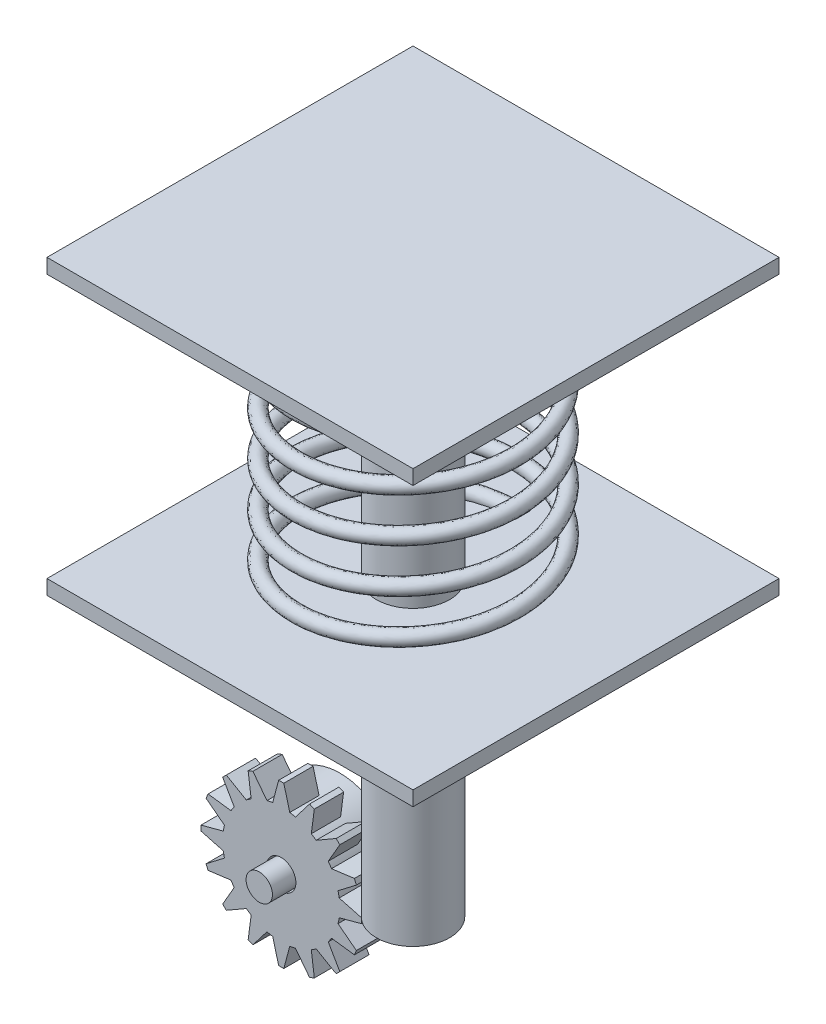
from build123d import *

# Parameters (mm, degrees)
EXTRUDE1_DEPTH       = 56
EXTRUDE1_DEPTH_BACK  = 20
SKETCH1_R            = 5
SHELL1_T             = -2
SKETCH7_W            = 50
SKETCH7_H            = 50
EXTRUDE4_DEPTH       = 2
SWEEP2_PITCH         = 6
EXTRUDE5_DEPTH       = 0.0001
EXTRUDE5_DEPTH_BACK  = 2
SKETCH10_W           = 50
SKETCH10_H           = 50
EXTRUDE9_DEPTH       = 2
EXTRUDE9_DEPTH_BACK  = 6
SKETCH14_R           = 8
SKETCH19_R           = 2
CUT_EXTRUDE2_DEPTH   = 71.356236477
EXTRUDE10_DEPTH      = 4
CIRPATTERN1_COUNT    = 16
EXTRUDE11_DEPTH      = 5
EXTRUDE11_DEPTH_BACK = 10
SKETCH21_R           = 1.8


with BuildPart() as part:
    # Sketch1 → Extrude1 (new, two sides: drawn at the far end of the back side and taken through both)
    with BuildSketch(Plane(origin=(0, 0, 0), x_dir=(1, 0, 0), z_dir=(0, 1, 0)).offset(-EXTRUDE1_DEPTH_BACK)):
        with Locations(Location((0, 0, 0), (0, 0, 270))):
            Circle(SKETCH1_R)
    extrude(amount=EXTRUDE1_DEPTH + EXTRUDE1_DEPTH_BACK)

    # Shell1
    shell1_openings = [part.faces().sort_by_distance(p)[0] for p in [
        (0, -20, 0),
    ]]
    offset(amount=SHELL1_T, openings=shell1_openings, kind=Kind.INTERSECTION)

    # Sketch7 → Extrude4 (add)
    with BuildSketch(Plane(origin=(0, 56, 0), x_dir=(-1, 0, 0), z_dir=(0, 1, 0))):
        Rectangle(SKETCH7_W, SKETCH7_H)
    extrude(amount=EXTRUDE4_DEPTH)

    # Sweep2: arcs per turn and ends read off the stored shape
    # Sweep2: the profile of Sketch9 screwed along a right-hand helix through 6 turns, 6 arcs to a turn; built about Z, then put on its axis
    sweep2_z = Axis((0, 0, 0), (0, 0, 1))
    sweep2_corners = [(15.988282835, -9.2086e-05, 0.036716591), (14.988282835, -8.6326e-05, -0.963283409), (13.988282835, -8.0567e-05, 0.036716591), (14.988282835, -8.6326e-05, 1.036716591)]
    with BuildLine(mode=Mode.PRIVATE) as sweep2_profile:
        ThreePointArc((15.988282835, -9.2086e-05, 0.036716591), (15.695389616, -9.0399e-05, -0.670390191), (14.988282835, -8.6326e-05, -0.963283409))
        ThreePointArc((14.988282835, -8.6326e-05, -0.963283409), (14.281176054, -8.2254e-05, -0.670390191), (13.988282835, -8.0567e-05, 0.036716591))
        ThreePointArc((13.988282835, -8.0567e-05, 0.036716591), (14.281176054, -8.2254e-05, 0.743823372), (14.988282835, -8.6326e-05, 1.036716591))
        ThreePointArc((14.988282835, -8.6326e-05, 1.036716591), (15.695389616, -9.0399e-05, 0.743823372), (15.988282835, -9.2086e-05, 0.036716591))
    sweep2_cap = Face(sweep2_profile.wire())
    sweep2_arcs = [((15.988282835, -9.2086e-05, 0.036716591), (15.988282835, -9.2086e-05, -0.963283409), (14.988282835, -8.6326e-05, -0.963283409), (1, 0.7071067811865476, 1)), ((14.988282835, -8.6326e-05, -0.963283409), (13.988282835, -8.0567e-05, -0.963283409), (13.988282835, -8.0567e-05, 0.036716591), (1, 0.7071067811865476, 1)), ((13.988282835, -8.0567e-05, 0.036716591), (13.988282835, -8.0567e-05, 1.036716591), (14.988282835, -8.6326e-05, 1.036716591), (1, 0.7071067811865476, 1)), ((14.988282835, -8.6326e-05, 1.036716591), (15.988282835, -9.2086e-05, 1.036716591), (15.988282835, -9.2086e-05, 0.036716591), (1, 0.7071067811865476, 1))]  # start, shoulder, end, weights
    sweep2_turn_angles = [0, 30, 60, 90, 120, 150, 180, 210, 240, 270, 300, 330, 360]
    sweep2_turn_weights = [1, 0.8660254037844387, 1, 0.8660254037844387, 1, 0.8660254037844387, 1, 0.8660254037844387, 1, 0.8660254037844387, 1, 0.8660254037844387, 1]
    sweep2_turn_sides = [Face.make_bezier_surface([[Vector(p[j][0], p[j][1], 0).rotate(sweep2_z, sweep2_turn_angles[2 * i + k]) / sweep2_turn_weights[2 * i + k] + Vector(0, 0, p[j][2] + SWEEP2_PITCH * sweep2_turn_angles[2 * i + k] / 360) for k in range(3)] for j in range(3)], [[p[3][j] * sweep2_turn_weights[2 * i + k] for k in range(3)] for j in range(3)]) for p in sweep2_arcs for i in range(6)]
    sweep2 = Plane(origin=(0, 56, 0), x_dir=(0, 0, -1), z_dir=(0, -1, 0)) * Solid(Shell([*[p.moved(Location((0, 0, SWEEP2_PITCH * i))) for i in range(6) for p in sweep2_turn_sides], sweep2_cap, sweep2_cap.rotate(sweep2_z, 2160).moved(Location((0, 0, SWEEP2_PITCH * 2160 / 360)))]))
    add(sweep2)

    # Sketch10 → Extrude5 (add, two sides: drawn at the far end of the back side and taken through both)
    with BuildSketch(Plane(origin=(0, 20, 0), x_dir=(-1, 0, 0), z_dir=(0, 1, 0)).offset(-EXTRUDE5_DEPTH_BACK)):
        Rectangle(SKETCH10_W, SKETCH10_H)
    extrude(amount=EXTRUDE5_DEPTH + EXTRUDE5_DEPTH_BACK)


with BuildPart() as body_2:
    # Sketch14 → Extrude9 (new, two sides: drawn at the far end of the back side and taken through both)
    with BuildSketch(Plane.XY.offset(-EXTRUDE9_DEPTH_BACK)):
        with Locations((-16, -22)):
            Circle(SKETCH14_R)
    extrude(amount=EXTRUDE9_DEPTH + EXTRUDE9_DEPTH_BACK)

    # Sketch19 → Cut-Extrude2 (cut, through all)
    with BuildSketch(Plane(origin=(0, 0, -6), x_dir=(-1, 0, 0), z_dir=(0, 0, -1))):
        with Locations((16, -22)):
            Circle(SKETCH19_R)
    extrude(amount=-CUT_EXTRUDE2_DEPTH, mode=Mode.SUBTRACT)

    # Sketch20 → Extrude10 (add)
    with BuildSketch(Plane.XY.offset(2)):
        Polygon((-17.4, -14.949083343), (-14.6, -14.949083343), (-15.648555205, -11.035822043), (-16.351444795, -11.035822043), align=None)
    extrude10 = extrude(amount=-EXTRUDE10_DEPTH)

    # CirPattern1: Extrude10 ×16 about axis
    cirpattern1_axis = Axis((-16, -22, 0), (0, 0, 1))
    for i in range(1, CIRPATTERN1_COUNT):
        add(extrude10.rotate(cirpattern1_axis, i * 360 / CIRPATTERN1_COUNT))


with BuildPart() as body_3:
    # Sketch21 → Extrude11 (new, two sides: drawn at the far end of the back side and taken through both)
    with BuildSketch(Plane.XY.offset(-EXTRUDE11_DEPTH_BACK)):
        with Locations((-16, -22)):
            Circle(SKETCH21_R)
    extrude(amount=EXTRUDE11_DEPTH + EXTRUDE11_DEPTH_BACK)


solid = Compound([part.part, body_2.part, body_3.part])
